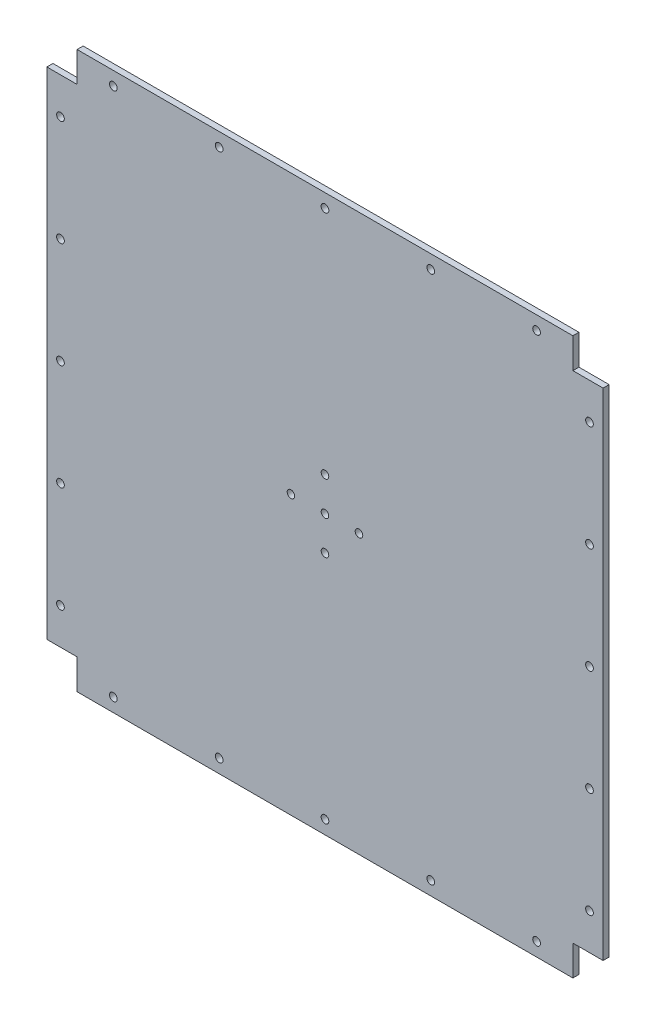
from build123d import *

# Parameters (mm, degrees)
SKETCH_1_W          = 368
SKETCH_1_H          = 368
EXTRUDE_1_DEPTH     = 4
SKETCH_3_R          = 2.55
CUT_EXTRUDE_2_DEPTH = 261.246037434
SKETCH_4_W          = 20
SKETCH_4_H          = 20
CUT_EXTRUDE_3_DEPTH = 261.246037434
SKETCH_5_R          = 2.5
CUT_EXTRUDE_6_DEPTH = 10


with BuildPart() as part:
    # 草图1 → 凸台-拉伸1 (new body)
    with BuildSketch(Plane.XY):
        Rectangle(SKETCH_1_W, SKETCH_1_H)
    extrude(amount=EXTRUDE_1_DEPTH)

    # 草图3 → 切除-拉伸2 (cut, through all)
    with BuildSketch(Plane.XY.offset(4)):
        with Locations((0, -175)):
            Circle(SKETCH_3_R)
        with Locations((70, -175)):
            Circle(SKETCH_3_R)
        with Locations((140, -175)):
            Circle(SKETCH_3_R)
        with Locations((-70, -175)):
            Circle(SKETCH_3_R)
        with Locations((-140, -175)):
            Circle(SKETCH_3_R)
        with Locations((-175, 140)):
            Circle(SKETCH_3_R)
        with Locations((-175, 70)):
            Circle(SKETCH_3_R)
        with Locations((-175, -70)):
            Circle(SKETCH_3_R)
        with Locations((-175, -140)):
            Circle(SKETCH_3_R)
        with Locations((-175, 0)):
            Circle(SKETCH_3_R)
        with Locations((140, 175)):
            Circle(SKETCH_3_R)
        with Locations((70, 175)):
            Circle(SKETCH_3_R)
        with Locations((-70, 175)):
            Circle(SKETCH_3_R)
        with Locations((-140, 175)):
            Circle(SKETCH_3_R)
        with Locations((0, 175)):
            Circle(SKETCH_3_R)
        with Locations((175, -140)):
            Circle(SKETCH_3_R)
        with Locations((175, -70)):
            Circle(SKETCH_3_R)
        with Locations((175, 70)):
            Circle(SKETCH_3_R)
        with Locations((175, 140)):
            Circle(SKETCH_3_R)
        with Locations((175, 0)):
            Circle(SKETCH_3_R)
    extrude(amount=-CUT_EXTRUDE_2_DEPTH, mode=Mode.SUBTRACT)

    # 草图4 → 切除-拉伸3 (cut, through all)
    with BuildSketch(Plane.XY.offset(4)):
        with Locations((-174, 174)):
            Rectangle(SKETCH_4_W, SKETCH_4_H)
        with Locations((-174, -174)):
            Rectangle(SKETCH_4_W, SKETCH_4_H)
        with Locations((174, 174)):
            Rectangle(SKETCH_4_W, SKETCH_4_H)
        with Locations((174, -174)):
            Rectangle(SKETCH_4_W, SKETCH_4_H)
    extrude(amount=-CUT_EXTRUDE_3_DEPTH, mode=Mode.SUBTRACT)

    # 草图5 → 切除-拉伸6 (cut)
    with BuildSketch(Plane.XY.offset(4)):
        with Locations((0, 22.5)):
            Circle(SKETCH_5_R)
        with Locations((22.5, 0)):
            Circle(SKETCH_5_R)
        with Locations((-22.5, 0)):
            Circle(SKETCH_5_R)
        with Locations((0, -22.5)):
            Circle(SKETCH_5_R)
        Circle(SKETCH_5_R)
    extrude(amount=-CUT_EXTRUDE_6_DEPTH, mode=Mode.SUBTRACT)


solid = part.part
